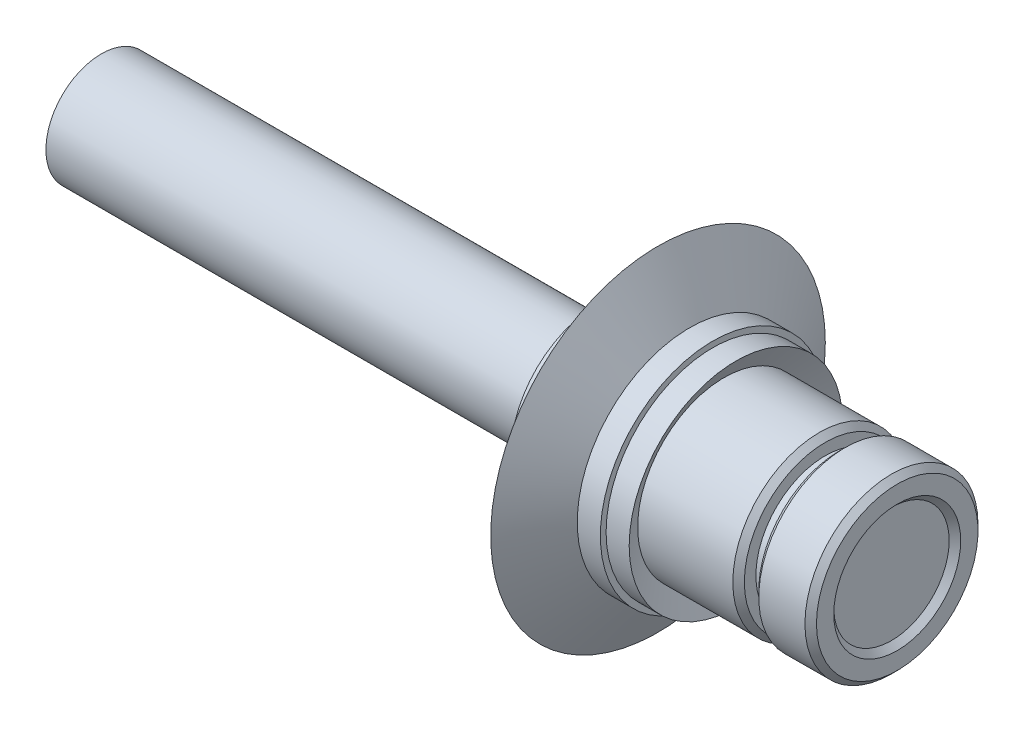
from build123d import *

# Parameters (mm, degrees)
CHANFREIN1_SIZE = 1


with BuildPart() as part:
    # Esquisse1 → Révolution2 (revolve)
    with BuildSketch(Plane.XY, mode=Mode.PRIVATE) as r_volution2_sk:
        Polygon((438.964577225, -15), (438.964577225, -12), (441.464577225, -12), (441.464577225, -15), (451.464577225, -15), (451.464577225, -10), (450.464577225, -10), (450.464577225, 0), (316.5, 0), (316.5, -7.6), (313.5, -7.6), (313.5, -9.6), (399.5, -9.6), (399.5, -15), (410, -15), (410, -29), (415.5, -19.5), (419.5, -19.5), (419.5, -18.5), (423.5, -18.5), (421.464577225, -15), align=None)
    revolve(r_volution2_sk.sketch.rotate(Axis((313.5, 0, 0), (-1, 0, 0)), 270), axis=Axis((313.5, 0, 0), (-1, 0, 0)))

    # Chanfrein1
    chanfrein1_edges = [part.edges().sort_by_distance(p)[0] for p in [
        (438.964577225, 0, 15),
        (441.464577225, 0, 15),
        (451.464577225, 0, 15),
        (451.464577225, 0, 10),
    ]]
    chamfer(chanfrein1_edges, length=CHANFREIN1_SIZE - 0.0001)  # a hair under: the kernel refuses the full size


solid = part.part
